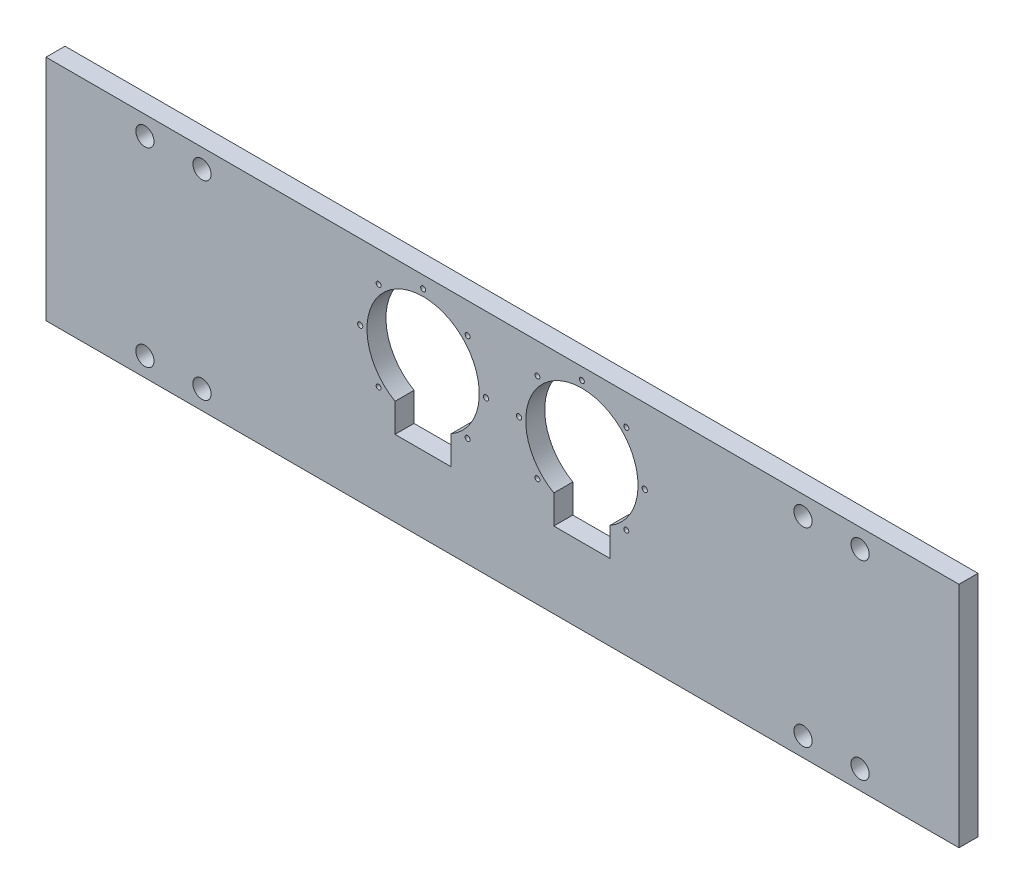
from build123d import *

# Parameters (mm, degrees)
SKETCH1_W           = 609.6
SKETCH1_H           = 152.4
SKETCH1_R           = 1.64973
SKETCH1_R_2         = 1.746
SKETCH1_R_3         = 6.096
BOSS_EXTRUDE1_DEPTH = 12.7


with BuildPart() as part:
    # Sketch1 → Boss-Extrude1 (new body)
    with BuildSketch(Plane.XY):
        Rectangle(SKETCH1_W, SKETCH1_H)
        with Locations((82.698486542, 55.898482492)):
            Circle(SKETCH1_R, mode=Mode.SUBTRACT)
        with Locations((95.00000245, 26.19999595)):
            Circle(SKETCH1_R_2, mode=Mode.SUBTRACT)
        with Locations((82.698486542, -3.498490592)):
            Circle(SKETCH1_R, mode=Mode.SUBTRACT)
        with Locations((23.301513458, -3.498490592)):
            Circle(SKETCH1_R, mode=Mode.SUBTRACT)
        with Locations((10.99999755, 26.19999595)):
            Circle(SKETCH1_R_2, mode=Mode.SUBTRACT)
        with Locations((23.301513458, 55.898482492)):
            Circle(SKETCH1_R, mode=Mode.SUBTRACT)
        with Locations((-53, 68.1999984)):
            Circle(SKETCH1_R, mode=Mode.SUBTRACT)
        with Locations((238.76, 63.5)):
            Circle(SKETCH1_R_3, mode=Mode.SUBTRACT)
        with Locations((200.66, 63.5)):
            Circle(SKETCH1_R_3, mode=Mode.SUBTRACT)
        with Locations((238.76, -63.5)):
            Circle(SKETCH1_R_3, mode=Mode.SUBTRACT)
        with Locations((200.66, -63.5)):
            Circle(SKETCH1_R_3, mode=Mode.SUBTRACT)
        with Locations((-82.698486542, -3.498490592)):
            Circle(SKETCH1_R, mode=Mode.SUBTRACT)
        with Locations((-95.00000245, 26.19999595)):
            Circle(SKETCH1_R_2, mode=Mode.SUBTRACT)
        with Locations((-82.698486542, 55.898482492)):
            Circle(SKETCH1_R, mode=Mode.SUBTRACT)
        with Locations((-23.301513458, 55.898482492)):
            Circle(SKETCH1_R, mode=Mode.SUBTRACT)
        with Locations((-10.99999755, 26.19999595)):
            Circle(SKETCH1_R_2, mode=Mode.SUBTRACT)
        with Locations((-23.301513458, -3.498490592)):
            Circle(SKETCH1_R, mode=Mode.SUBTRACT)
        with Locations((-238.76, 63.5)):
            Circle(SKETCH1_R_3, mode=Mode.SUBTRACT)
        with Locations((-200.66, 63.5)):
            Circle(SKETCH1_R_3, mode=Mode.SUBTRACT)
        with Locations((-200.66, -63.5)):
            Circle(SKETCH1_R_3, mode=Mode.SUBTRACT)
        with Locations((-238.76, -63.5)):
            Circle(SKETCH1_R_3, mode=Mode.SUBTRACT)
        with Locations((53, 68.1999984)):
            Circle(SKETCH1_R, mode=Mode.SUBTRACT)
        with BuildLine():
            Line((34.25, -6.275954242), (34.25, -25.4))
            Line((34.25, -25.4), (71.75, -25.4))
            Line((71.75, -25.4), (71.75, -6.275954242))
            ThreePointArc((71.75, -6.275954242), (53, 63.6999984), (34.25, -6.275954242))
        make_face(mode=Mode.SUBTRACT)
        with BuildLine():
            Line((-34.25, -6.275954242), (-34.25, -25.4))
            Line((-34.25, -25.4), (-71.75, -25.4))
            Line((-71.75, -25.4), (-71.75, -6.275954242))
            ThreePointArc((-71.75, -6.275954242), (-53, 63.6999984), (-34.25, -6.275954242))
        make_face(mode=Mode.SUBTRACT)
    extrude(amount=BOSS_EXTRUDE1_DEPTH)


solid = part.part
